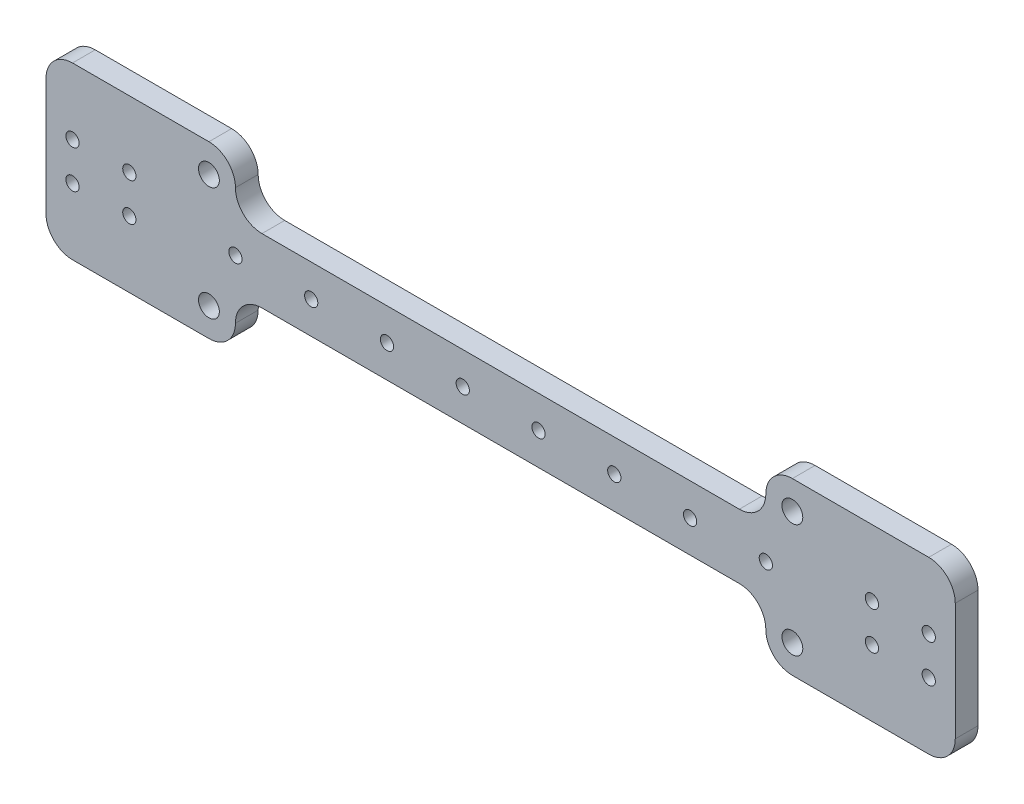
from build123d import *

# Parameters (mm, degrees)
SKETCH1_W           = 240
SKETCH1_H           = 25
SKETCH1_R           = 1.75
BOSS_EXTRUDE1_DEPTH = 6
SKETCH2_W           = 50
SKETCH2_H           = 10
BOSS_EXTRUDE2_DEPTH = 6
SKETCH3_W           = 140
SKETCH3_H           = 4
CUT_EXTRUDE1_DEPTH  = 235.693949645
SKETCH4_R           = 2.75
CUT_EXTRUDE2_DEPTH  = 235.693949645
FILLET1_R           = 7


with BuildPart() as part:
    # Sketch1 → Boss-Extrude1 (new body)
    with BuildSketch(Plane.XY):
        with Locations((113, -5)):
            Rectangle(SKETCH1_W, SKETCH1_H)
        Circle(SKETCH1_R, mode=Mode.SUBTRACT)
        with Locations((226, 0)):
            Circle(SKETCH1_R, mode=Mode.SUBTRACT)
        with Locations((15, 0)):
            Circle(SKETCH1_R, mode=Mode.SUBTRACT)
        with Locations((0, -10)):
            Circle(SKETCH1_R, mode=Mode.SUBTRACT)
        with Locations((15, -10)):
            Circle(SKETCH1_R, mode=Mode.SUBTRACT)
        with Locations((211, 0)):
            Circle(SKETCH1_R, mode=Mode.SUBTRACT)
        with Locations((211, -10)):
            Circle(SKETCH1_R, mode=Mode.SUBTRACT)
        with Locations((226, -10)):
            Circle(SKETCH1_R, mode=Mode.SUBTRACT)
        with Locations((183, -5)):
            Circle(SKETCH1_R, mode=Mode.SUBTRACT)
        with Locations((163, -5)):
            Circle(SKETCH1_R, mode=Mode.SUBTRACT)
        with Locations((143, -5)):
            Circle(SKETCH1_R, mode=Mode.SUBTRACT)
        with Locations((123, -5)):
            Circle(SKETCH1_R, mode=Mode.SUBTRACT)
        with Locations((103, -5)):
            Circle(SKETCH1_R, mode=Mode.SUBTRACT)
        with Locations((83, -5)):
            Circle(SKETCH1_R, mode=Mode.SUBTRACT)
        with Locations((63, -5)):
            Circle(SKETCH1_R, mode=Mode.SUBTRACT)
        with Locations((43, -5)):
            Circle(SKETCH1_R, mode=Mode.SUBTRACT)
    extrude(amount=BOSS_EXTRUDE1_DEPTH)

    # Sketch2 → Boss-Extrude2 (add)
    with BuildSketch(Plane.XY.offset(6)):
        with Locations((18, -22.5)):
            Rectangle(SKETCH2_W, SKETCH2_H)
        with Locations((18, 12.5)):
            Rectangle(SKETCH2_W, SKETCH2_H)
        with Locations((208, 12.5)):
            Rectangle(SKETCH2_W, SKETCH2_H)
        with Locations((208, -22.5)):
            Rectangle(SKETCH2_W, SKETCH2_H)
    extrude(amount=-BOSS_EXTRUDE2_DEPTH)

    # Sketch3 → Cut-Extrude1 (cut, through all)
    with BuildSketch(Plane(origin=(0, 0, 0), x_dir=(-1, 0, 0), z_dir=(0, 0, -1))):
        with Locations((-113, 5.5)):
            Rectangle(SKETCH3_W, SKETCH3_H)
        with Locations((-113, -15.5)):
            Rectangle(SKETCH3_W, SKETCH3_H)
    extrude(amount=-CUT_EXTRUDE1_DEPTH, mode=Mode.SUBTRACT)

    # Sketch4 → Cut-Extrude2 (cut, through all)
    with BuildSketch(Plane.XY.offset(6)):
        with Locations((36, -20)):
            Circle(SKETCH4_R)
        with Locations(Location((36, 10, 0), (0, 0, 180))):
            Circle(SKETCH4_R)
        with Locations((190, 10)):
            Circle(SKETCH4_R)
        with Locations(Location((190, -20, 0), (0, 0, 180))):
            Circle(SKETCH4_R)
    extrude(amount=-CUT_EXTRUDE2_DEPTH, mode=Mode.SUBTRACT)

    # Fillet1
    fillet1_edges = [part.edges().sort_by_distance(p)[0] for p in [
        (183, 3.5, 3),
        (183, 17.5, 3),
        (233, 17.5, 3),
        (233, -27.5, 3),
        (183, -13.5, 3),
        (183, -27.5, 3),
        (43, -13.5, 3),
        (43, 3.5, 3),
        (43, 17.5, 3),
        (-7, 17.5, 3),
        (43, -27.5, 3),
        (-7, -27.5, 3),
    ]]
    fillet(fillet1_edges, radius=FILLET1_R - 0.0001)  # a hair under: the kernel refuses the full size


solid = part.part
